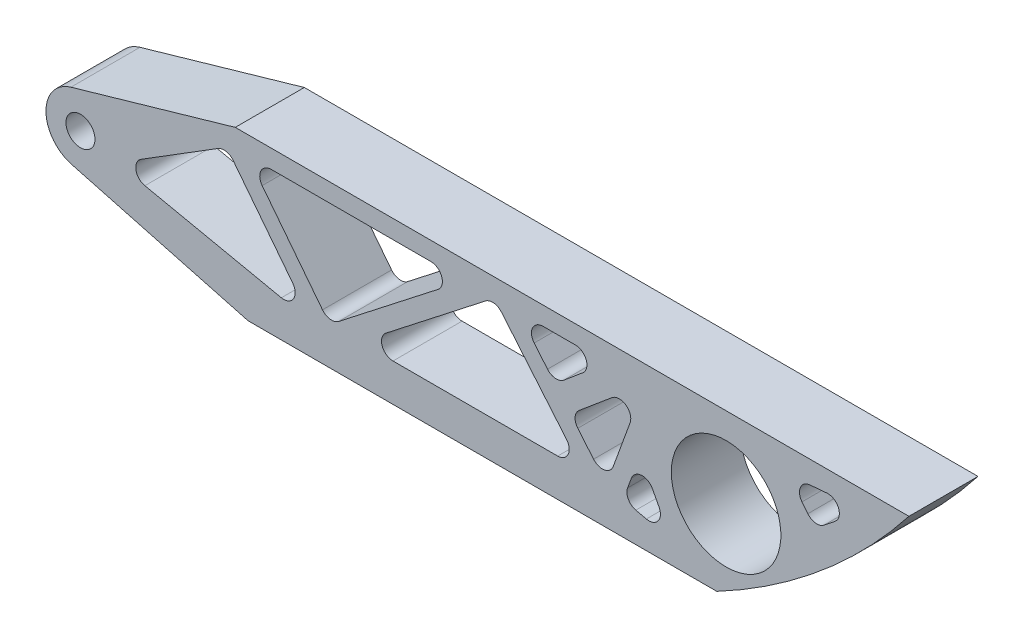
from build123d import *

# Parameters (mm, degrees)
SKETCH1_W           = 241.3
SKETCH1_H           = 44.45
BOSS_EXTRUDE1_DEPTH = 19.06
SKETCH3_R           = 4
CUT_EXTRUDE1_DEPTH  = 125.151748779
CUT_EXTRUDE2_DEPTH  = 125.151748779
SKETCH11_R          = 15.113
CUT_EXTRUDE3_DEPTH  = 125.151748779
CUT_EXTRUDE5_DEPTH  = 125.151748779
FILLET1_R           = 3.175


with BuildPart() as part:
    # Sketch1 → Boss-Extrude1 (new body)
    with BuildSketch(Plane.XY):
        Rectangle(SKETCH1_W, SKETCH1_H)
    extrude(amount=BOSS_EXTRUDE1_DEPTH)

    # Sketch3 → Cut-Extrude1 (cut, through all)
    with BuildSketch(Plane.XY.offset(19.06)):
        with Locations((-107.95, 0)):
            Circle(SKETCH3_R)
    extrude(amount=-CUT_EXTRUDE1_DEPTH, mode=Mode.SUBTRACT)

    # Sketch5 → Cut-Extrude2 (cut, through all)
    with BuildSketch(Plane.XY.offset(19.06)):
        with BuildLine():
            Line((-61.710210997, -22.225), (-110.410681995, -9.201666649))
            ThreePointArc((-110.410681995, -9.201666649), (-117.474553903, -0.092184338), (-110.588322829, 9.152315426))
            Line((-110.588322829, 9.152315426), (-65.239311186, 22.225))
            Line((-65.239311186, 22.225), (-120.65, 22.225))
            Line((-120.65, 22.225), (-120.65, -22.225))
            Line((-120.65, -22.225), (-61.710210997, -22.225))
        make_face()
        with BuildLine():
            ThreePointArc((120.65, 22.225), (96.497916739, -2.807923084), (67.637087091, -22.225))
            Line((67.637087091, -22.225), (120.65, -22.225))
            Line((120.65, -22.225), (120.65, 22.225))
        make_face()
    extrude(amount=-CUT_EXTRUDE2_DEPTH, mode=Mode.SUBTRACT)

    # Sketch11 → Cut-Extrude3 (cut, through all)
    with BuildSketch(Plane(origin=(0, 0, 0), x_dir=(-1, 0, 0), z_dir=(0, 0, -1))):
        with Locations((-70.2, 0)):
            Circle(SKETCH11_R)
    extrude(amount=-CUT_EXTRUDE3_DEPTH, mode=Mode.SUBTRACT)

    # Sketch14 → Cut-Extrude5 (cut, through all)
    with BuildSketch(Plane.XY.offset(19.06)):
        Polygon((87.427282936, 15.558708401), (94.741989073, 6.41532573), (108.43714596, 17.350301349), align=None)
        Polygon((6.23809101, 17.145), (30.535346935, -11.846001721), (-30.948660953, -11.846001721), align=None)
        Polygon((46.510408136, -0.263266999), (41.797756922, -13.171817861), (54.981736877, -16.224950062), align=None)
        Polygon((-2.024242446, 17.145), (-61.812542984, 17.145), (-39.21099441, -11.846001721), align=None)
        Polygon((-67.587212684, 16.289834184), (-44.018850929, -13.941298607), (-97.910045601, -2.558530136), align=None)
        Polygon((12.866285475, 17.145), (22.970817577, 5.088473597), (37.356424692, 17.145), align=None)
        Polygon((47.771839702, 17.211476115), (27.235449288, 0), (37.1635414, -11.846001721), align=None)
    extrude(amount=-CUT_EXTRUDE5_DEPTH, mode=Mode.SUBTRACT)

    # Fillet1
    fillet1_edges = [part.edges().sort_by_distance(p)[0] for p in [
        (-67.587212684, 16.289834184, 9.53),
        (-44.018850929, -13.941298607, 9.53),
        (-97.910045601, -2.558530136, 9.53),
        (-61.812542984, 17.145, 9.53),
        (-2.024242446, 17.145, 9.53),
        (-39.21099441, -11.846001721, 9.53),
        (-30.948660953, -11.846001721, 9.53),
        (6.23809101, 17.145, 9.53),
        (30.535346935, -11.846001721, 9.53),
        (87.427282936, 15.558708401, 9.53),
        (108.43714596, 17.350301349, 9.53),
        (94.741989073, 6.41532573, 9.53),
        (47.771839702, 17.211476115, 9.53),
        (22.970817577, 5.088473597, 9.53),
        (37.356424692, 17.145, 9.53),
        (12.866285475, 17.145, 9.53),
        (27.235449288, 0, 9.53),
        (37.1635414, -11.846001721, 9.53),
        (46.510408136, -0.263266999, 9.53),
        (54.981736877, -16.224950062, 9.53),
        (41.797756922, -13.171817861, 9.53),
    ]]
    fillet(fillet1_edges, radius=FILLET1_R)


solid = part.part
